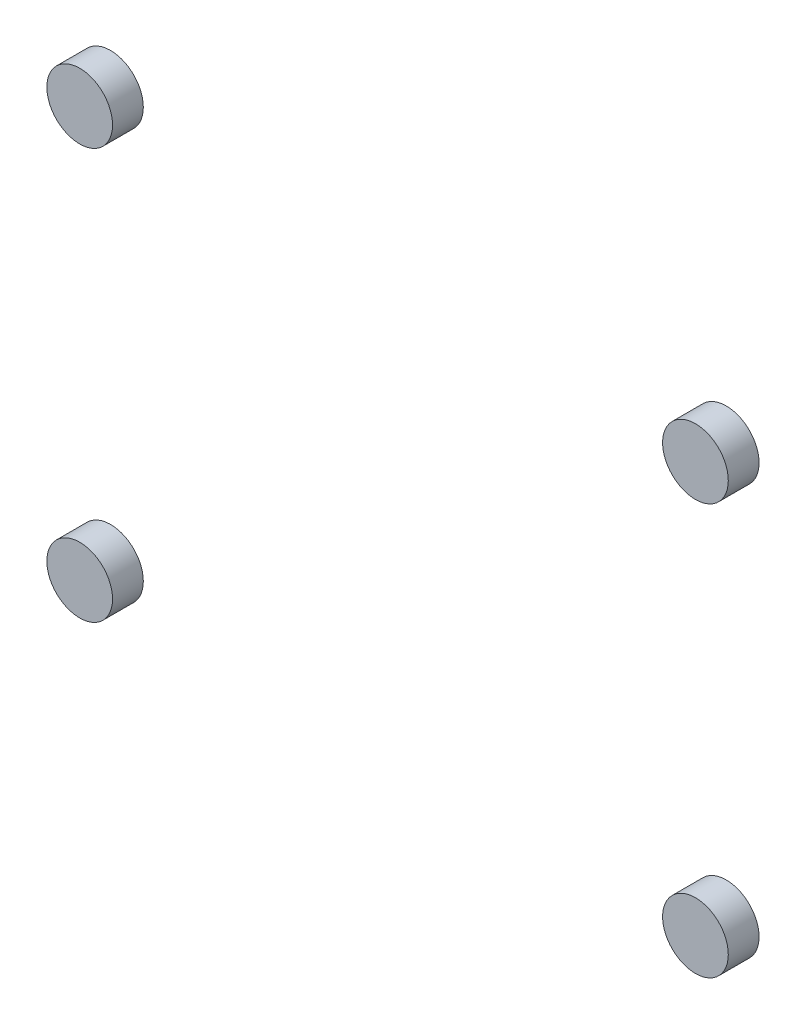
from build123d import *

# Parameters (mm, degrees)
SKETCH3_R             = 3.2
BOSS_EXTRUDE2_DEPTH   = 3
BOSS_EXTRUDE2_2_DEPTH = 3
BOSS_EXTRUDE2_3_DEPTH = 3
BOSS_EXTRUDE2_4_DEPTH = 3


with BuildPart() as part:
    # Sketch3 → Boss-Extrude2 (new body)
    with BuildSketch(Plane.XY):
        with Locations((-30, -20)):
            Circle(SKETCH3_R)
    extrude(amount=BOSS_EXTRUDE2_DEPTH)


with BuildPart() as body_2:
    # Sketch3 → Boss-Extrude2 2 (new body)
    with BuildSketch(Plane.XY):
        with Locations((30, -20)):
            Circle(SKETCH3_R)
    extrude(amount=BOSS_EXTRUDE2_2_DEPTH)


with BuildPart() as body_3:
    # Sketch3 → Boss-Extrude2 3 (new body)
    with BuildSketch(Plane.XY):
        with Locations((-30, 20)):
            Circle(SKETCH3_R)
    extrude(amount=BOSS_EXTRUDE2_3_DEPTH)


with BuildPart() as body_4:
    # Sketch3 → Boss-Extrude2 4 (new body)
    with BuildSketch(Plane.XY):
        with Locations((30, 20)):
            Circle(SKETCH3_R)
    extrude(amount=BOSS_EXTRUDE2_4_DEPTH)


solid = Compound([part.part, body_2.part, body_3.part, body_4.part])
